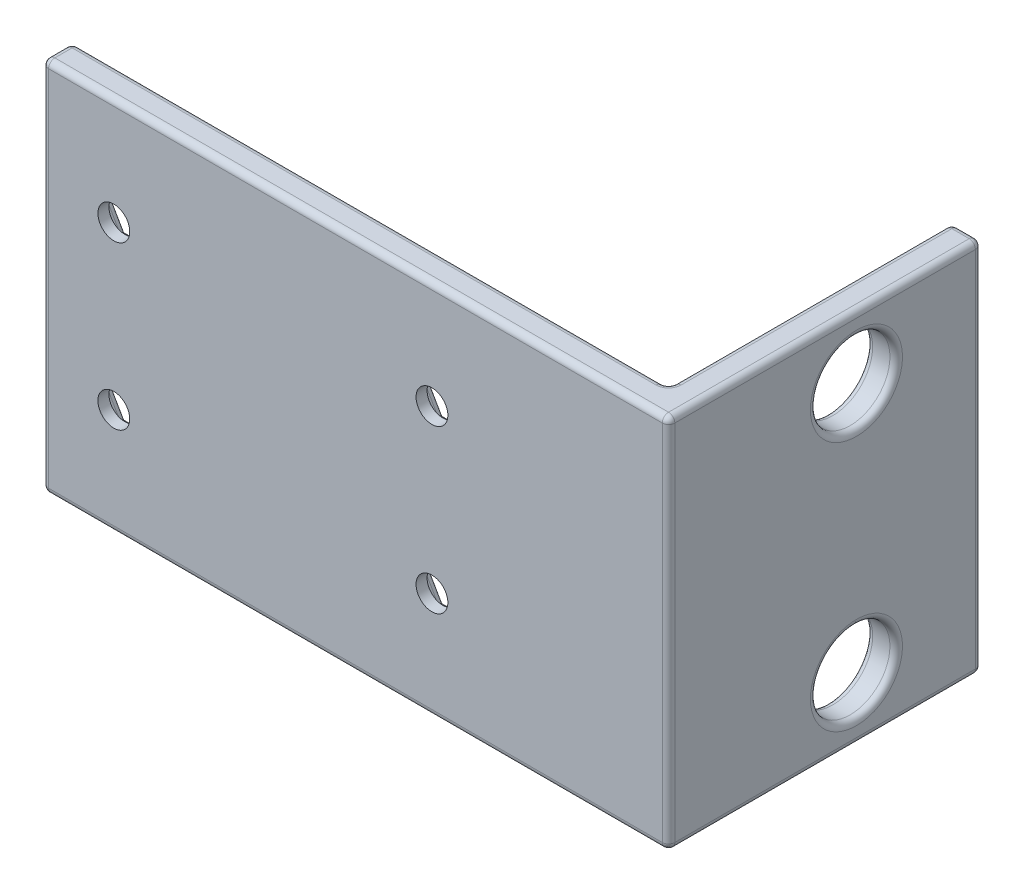
from build123d import *

# Parameters (mm, degrees)
BOSS_EXTRUDE1_DEPTH = 30
SKETCH2_R           = 1.27
CUT_EXTRUDE1_DEPTH  = 62.583645163
SKETCH3_R           = 3.175
CUT_EXTRUDE2_DEPTH  = 63.542848125
FILLET1_R           = 0.5
CUT_EXTRUDE3_DEPTH  = 1.5
FILLET2_R           = 0.5


with BuildPart() as part:
    # Sketch1 → Boss-Extrude1 (new body)
    with BuildSketch(Plane(origin=(0, 0, 0), x_dir=(1, 0, 0), z_dir=(0, 1, 0))):
        Polygon((0, 0), (0, 22.61875), (2.38125, 22.61875), (2.38125, -2.38125), (-47.61875, -2.38125), (-47.61875, 0), align=None)
    extrude(amount=BOSS_EXTRUDE1_DEPTH)

    # Sketch2 → Cut-Extrude1 (cut, through all)
    with BuildSketch(Plane.XY.offset(2.38125)):
        with Locations((-41.91, 8.523)):
            Circle(SKETCH2_R)
        with Locations((-16.51, 8.523)):
            Circle(SKETCH2_R)
        with Locations((-16.51, 21.477)):
            Circle(SKETCH2_R)
        with Locations((-41.91, 21.477)):
            Circle(SKETCH2_R)
    extrude(amount=-CUT_EXTRUDE1_DEPTH, mode=Mode.SUBTRACT)

    # Sketch3 → Cut-Extrude2 (cut, through all)
    with BuildSketch(Plane(origin=(2.38125, 0, 0), x_dir=(0, 0, -1), z_dir=(1, 0, 0))):
        with Locations((12.61875, 25)):
            Circle(SKETCH3_R)
        with Locations((12.61875, 5)):
            Circle(SKETCH3_R)
    extrude(amount=-CUT_EXTRUDE2_DEPTH, mode=Mode.SUBTRACT)

    # Fillet1
    fillet1_edges = [part.edges().sort_by_distance(p)[0] for p in [
        (-47.61875, 15, 2.38125),
        (-47.61875, 0, 1.190625),
        (-22.61875, 0, 2.38125),
        (2.38125, 15, 2.38125),
        (2.38125, 0, -10.11875),
        (2.38125, 5, -9.44375),
        (2.38125, 25, -9.44375),
        (2.38125, 15, -22.61875),
        (1.190625, 0, -22.61875),
        (1.190625, 30, -22.61875),
        (2.38125, 30, -10.11875),
        (-22.61875, 30, 2.38125),
        (-47.61875, 30, 1.190625),
        (0, 15, -22.61875),
        (0, 30, -11.309375),
        (0, 0, -11.309375),
        (0, 5, -9.44375),
        (0, 25, -9.44375),
        (0, 15, 0),
        (-23.809375, 30, 0),
        (-47.61875, 15, 0),
        (-23.809375, 0, 0),
        (-43.18, 8.523, 0),
        (-17.78, 8.523, 0),
        (-17.78, 21.477, 0),
        (-43.18, 21.477, 0),
    ]]
    fillet(fillet1_edges, radius=FILLET1_R)

    # Sketch5 → Cut-Extrude3 (cut)
    with BuildSketch(Plane(origin=(0, 0, 0), x_dir=(-1, 0, 0), z_dir=(0, 0, -1))):
        Polygon((19.281281292, 21.477), (17.895640646, 23.877), (15.124359354, 23.877), (13.738718708, 21.477), (15.124359354, 19.077), (17.895640646, 19.077), align=None)
        Polygon((19.281281292, 8.523), (17.895640646, 10.923), (15.124359354, 10.923), (13.738718708, 8.523), (15.124359354, 6.123), (17.895640646, 6.123), align=None)
        Polygon((39.138718708, 8.523), (40.524359354, 6.123), (43.295640646, 6.123), (44.681281292, 8.523), (43.295640646, 10.923), (40.524359354, 10.923), align=None)
        Polygon((39.138718708, 21.477), (40.524359354, 19.077), (43.295640646, 19.077), (44.681281292, 21.477), (43.295640646, 23.877), (40.524359354, 23.877), align=None)
    extrude(amount=-CUT_EXTRUDE3_DEPTH, mode=Mode.SUBTRACT)

    # Fillet2
    fillet2_edges = [part.edges().sort_by_distance(p)[0] for p in [
        (-16.51, 23.877, 0),
        (-14.431539031, 22.677, 0),
        (-14.431539031, 20.277, 0),
        (-16.51, 19.077, 0),
        (-18.588460969, 20.277, 0),
        (-18.588460969, 22.677, 0),
        (-16.51, 10.923, 0),
        (-14.431539031, 9.723, 0),
        (-14.431539031, 7.323, 0),
        (-16.51, 6.123, 0),
        (-18.588460969, 7.323, 0),
        (-18.588460969, 9.723, 0),
        (-41.91, 6.123, 0),
        (-43.988460969, 7.323, 0),
        (-43.988460969, 9.723, 0),
        (-41.91, 10.923, 0),
        (-39.831539031, 9.723, 0),
        (-39.831539031, 7.323, 0),
        (-41.91, 19.077, 0),
        (-43.988460969, 20.277, 0),
        (-43.988460969, 22.677, 0),
        (-41.91, 23.877, 0),
        (-39.831539031, 22.677, 0),
        (-39.831539031, 20.277, 0),
    ]]
    fillet(fillet2_edges, radius=FILLET2_R)


solid = part.part
